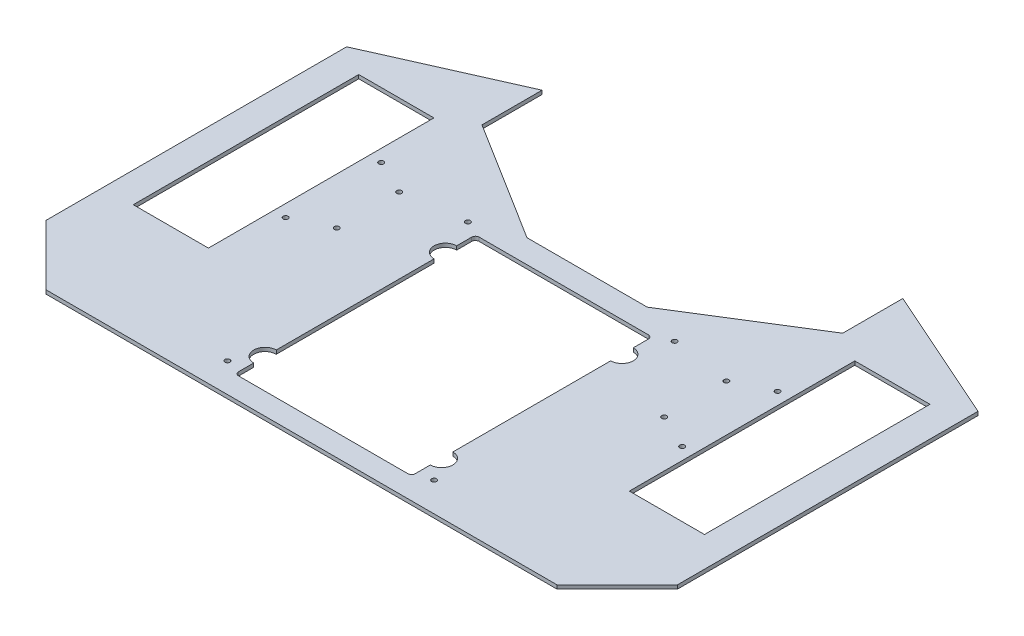
from build123d import *

# Parameters (mm, degrees)
SKETCH1_W           = 63.5
SKETCH1_H           = 190.5
BOSS_EXTRUDE1_DEPTH = 3.175
SKETCH3_R           = 2.0828
CUT_EXTRUDE2_DEPTH  = 526.850378691
SKETCH4_R           = 2.0828
CUT_EXTRUDE4_DEPTH  = 526.850378691
FILLET2_R           = 3.175


with BuildPart() as part:
    # Sketch1 → Boss-Extrude1 (new body)
    with BuildSketch(Plane(origin=(0, 0, 0), x_dir=(1, 0, 0), z_dir=(0, 1, 0))):
        Polygon((-242.686835374, -133.432512515), (-242.686835374, -385.491221995), (-242.686835374, -387.371651362), (-191.886835374, -438.171651362), (239.913164626, -438.171651362), (290.713164626, -387.371651362), (290.713164626, -133.371651362), (176.413164626, -82.571651362), (176.413164626, -133.371651362), (74.813164626, -196.871651362), (-26.786835374, -196.871651362), (-128.386835374, -133.371651362), (-128.386835374, -82.571651362), (-242.686835374, -133.371651362), align=None)
        with Locations((233.563164626, -243.80020948)):
            Rectangle(SKETCH1_W, SKETCH1_H, mode=Mode.SUBTRACT)
        with Locations((-185.536835374, -243.80020948)):
            Rectangle(SKETCH1_W, SKETCH1_H, mode=Mode.SUBTRACT)
    extrude(amount=BOSS_EXTRUDE1_DEPTH)

    # Sketch3 → Cut-Extrude2 (cut, through all)
    with BuildSketch(Plane(origin=(0, 0, 0), x_dir=(1, 0, 0), z_dir=(0, 1, 0))):
        with Locations((-114.278235374, -270.125471314)):
            Circle(SKETCH3_R)
        with Locations((-143.449035374, -284.13540948)):
            Circle(SKETCH3_R)
        with Locations((-114.278235374, -217.474947647)):
            Circle(SKETCH3_R)
        with Locations((-143.449035374, -203.46500948)):
            Circle(SKETCH3_R)
        with Locations((191.475364626, -284.13540948)):
            Circle(SKETCH3_R)
        with Locations((162.304564626, -270.125471314)):
            Circle(SKETCH3_R)
        with Locations((162.304564626, -217.474947647)):
            Circle(SKETCH3_R)
        with Locations((191.475364626, -203.46500948)):
            Circle(SKETCH3_R)
    extrude(amount=CUT_EXTRUDE2_DEPTH, mode=Mode.SUBTRACT)

    # Sketch4 → Cut-Extrude4 (cut, through all)
    with BuildSketch(Plane(origin=(0, 0, 0), x_dir=(1, 0, 0), z_dir=(0, 1, 0))):
        with Locations((111.325664626, -210.298576853)):
            Circle(SKETCH4_R)
        with Locations((111.325664626, -413.498576853)):
            Circle(SKETCH4_R)
        with Locations((-63.299335374, -413.498576853)):
            Circle(SKETCH4_R)
        with Locations((-63.299335374, -210.298576853)):
            Circle(SKETCH4_R)
        with BuildLine():
            Line((-50.599335374, -216.648576853), (98.625664626, -216.648576853))
            Line((98.625664626, -216.648576853), (98.625664626, -232.523576853))
            ThreePointArc((98.625664626, -232.523576853), (108.150664626, -242.048576853), (98.625664626, -251.573576853))
            Line((98.625664626, -251.573576853), (98.625664626, -384.923576853))
            ThreePointArc((98.625664626, -384.923576853), (108.150664626, -394.448576853), (98.625664626, -403.973576853))
            Line((98.625664626, -403.973576853), (98.625664626, -419.848576853))
            Line((98.625664626, -419.848576853), (-50.599335374, -419.848576853))
            Line((-50.599335374, -419.848576853), (-50.599335374, -403.973576853))
            ThreePointArc((-50.599335374, -403.973576853), (-60.124335374, -394.448576853), (-50.599335374, -384.923576853))
            Line((-50.599335374, -384.923576853), (-50.599335374, -251.573576853))
            ThreePointArc((-50.599335374, -251.573576853), (-60.124335374, -242.048576853), (-50.599335374, -232.523576853))
            Line((-50.599335374, -232.523576853), (-50.599335374, -216.648576853))
        make_face()
    extrude(amount=CUT_EXTRUDE4_DEPTH, mode=Mode.SUBTRACT)

    # Fillet2
    fillet2_edges = [part.edges().sort_by_distance(p)[0] for p in [
        (-50.599335374, 1.5875, 419.848576853),
        (98.625664626, 1.5875, 419.848576853),
        (98.625664626, 1.5875, 216.648576853),
        (-50.599335374, 1.5875, 216.648576853),
    ]]
    fillet(fillet2_edges, radius=FILLET2_R)


solid = part.part
